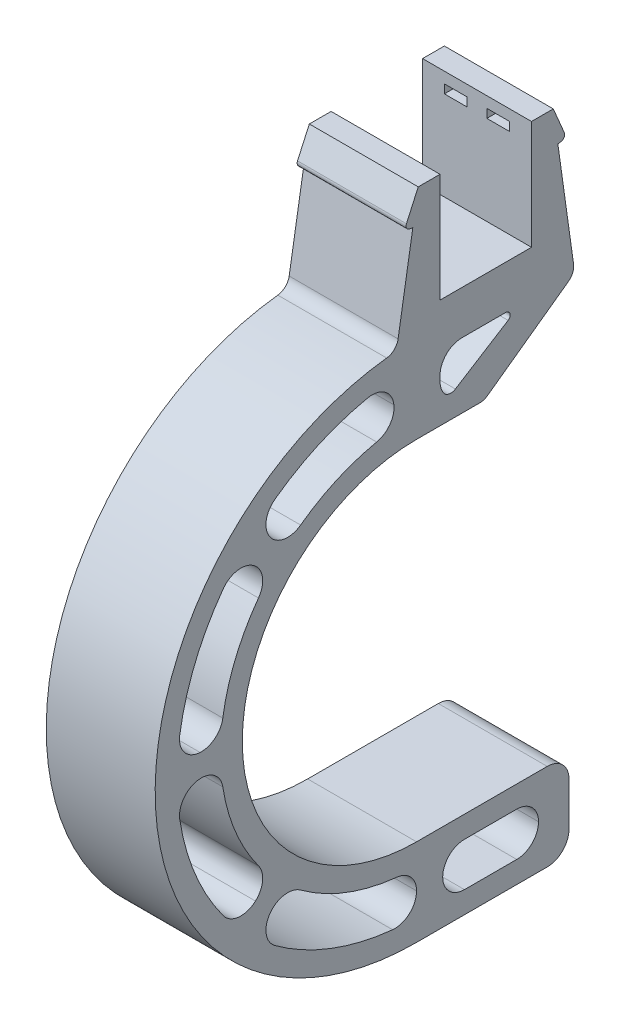
from build123d import *

# Parameters (mm, degrees)
SKETCH1_W               = 22
SKETCH1_H               = 10
BOSS_EXTRUDE1_DEPTH     = 25
FILLET1_R               = 5
FILLET2_R               = 5
FILLET3_R               = 5
FILLET4_R               = 5
FILLET5_R               = 2
FILLET6_R               = 1
FILLET7_R               = 3
FILLET8_R               = 5
CUT_EXTRUDE1_DEPTH      = 35
CUT_EXTRUDE1_DEPTH_BACK = 25
SKETCH2_W               = 5.25
SKETCH2_H               = 2
BOSS_EXTRUDE2_DEPTH     = 25
FILLET9_R               = 1


# Some blends are built 0.0001 mm under size
with BuildPart() as part:
    # Sketch1 → Boss-Extrude1 (new body)
    with BuildSketch(Plane(origin=(0, 0, 0), x_dir=(0, 0, -1), z_dir=(1, 0, 0))):
        with BuildLine():
            ThreePointArc((-15.5, -17.5), (-55.5, -57.5), (-15.5, -97.5))
            Line((-15.5, -97.5), (19.5, -97.5))
            Line((19.5, -97.5), (19.5, -117.5))
            Line((19.5, -117.5), (-15.5, -117.5))
            ThreePointArc((-15.5, -117.5), (-75.455538985, -59.809403615), (-20.115384615, 2.322221831))
            Line((-20.115384615, 2.322221831), (-15.115384615, 32.514814847))
            Line((-15.115384615, 32.514814847), (-10.115384615, 32.514814847))
            Line((-10.115384615, 32.514814847), (-10.115384615, 7.5))
            Line((-10.115384615, 7.5), (10.884615385, 7.5))
            Line((10.884615385, 7.5), (10.884615385, 32.514814847))
            Line((10.884615385, 32.514814847), (15.884615385, 32.514814847))
            Line((15.884615385, 32.514814847), (20.8, -2.5))
            Line((20.8, -2.5), (0, -17.5))
            Line((0, -17.5), (-15.5, -17.5))
        make_face()
        with BuildLine():
            ThreePointArc((-52.30218335, -98.372965401), (-35.210237225, -108.846923457), (-15.5, -112.5))
            Line((-15.5, -112.5), (-15.5, -102.5))
            ThreePointArc((-15.5, -102.5), (-31.62655773, -99.511119192), (-45.610877286, -90.941517146))
            Line((-45.610877286, -90.941517146), (-52.30218335, -98.372965401))
        make_face(mode=Mode.SUBTRACT)
        with BuildLine():
            ThreePointArc((-56.372965401, -20.69781665), (-66.313374288, -36.45241122), (-70.424624412, -54.621522407))
            Line((-70.424624412, -54.621522407), (-60.438329064, -55.144881969))
            ThreePointArc((-60.438329064, -55.144881969), (-57.074578963, -40.279245544), (-48.941517146, -27.389122714))
            Line((-48.941517146, -27.389122714), (-56.372965401, -20.69781665))
        make_face(mode=Mode.SUBTRACT)
        with BuildLine():
            ThreePointArc((-21.24906548, -2.801295755), (-37.870515369, -7.25499983), (-52.30218335, -16.627034599))
            Line((-52.30218335, -16.627034599), (-45.610877286, -24.058482854))
            ThreePointArc((-45.610877286, -24.058482854), (-33.803148938, -16.390454406), (-20.203780847, -12.746514708))
            Line((-20.203780847, -12.746514708), (-21.24906548, -2.801295755))
        make_face(mode=Mode.SUBTRACT)
        Polygon((8.463652775, -2.5), (-7.917479229, -12.773905232), (-10.115384615, -12.773905232), (-10.115384615, -2.5), align=None, mode=Mode.SUBTRACT)
        with Locations((1.5, -107.5)):
            Rectangle(SKETCH1_W, SKETCH1_H, mode=Mode.SUBTRACT)
        with BuildLine():
            Line((-60.438329064, -59.855118031), (-70.424624412, -60.378477593))
            ThreePointArc((-70.424624412, -60.378477593), (-66.313374288, -78.54758878), (-56.372965401, -94.30218335))
            Line((-56.372965401, -94.30218335), (-48.941517146, -87.610877286))
            ThreePointArc((-48.941517146, -87.610877286), (-57.074578963, -74.720754456), (-60.438329064, -59.855118031))
        make_face(mode=Mode.SUBTRACT)
    extrude(amount=-BOSS_EXTRUDE1_DEPTH)

    # Fillet1
    fillet1_edges = [part.edges().sort_by_distance(p)[0] for p in [
        (-12.5, -90.941517146, 45.610877286),
        (-12.5, -102.5, 9.5),
        (-12.5, -112.5, 9.5),
        (-12.5, -112.5, 15.5),
        (-12.5, -112.5, -12.5),
        (-12.5, -102.5, -12.5),
        (-12.5, -98.372965401, 52.30218335),
        (-12.5, -102.5, 15.5),
        (-12.5, -87.610877286, 48.941517146),
        (-12.5, -94.30218335, 56.372965401),
        (-12.5, -20.69781665, 56.372965401),
        (-12.5, -27.389122714, 48.941517146),
        (-12.5, -55.144881969, 60.438329064),
        (-12.5, -54.621522407, 70.424624412),
        (-12.5, -16.627034599, 52.30218335),
        (-12.5, -24.058482854, 45.610877286),
        (-12.5, -12.746514708, 20.203780847),
        (-12.5, -2.801295755, 21.24906548),
    ]]
    fillet(fillet1_edges, radius=FILLET1_R - 0.0001)  # a hair under: the kernel refuses the full size

    # Fillet2
    fillet2_edges = [part.edges().sort_by_distance(p)[0] for p in [
        (-12.5, -59.855118031, 60.438329064),
        (-12.5, -60.378477593, 70.424624412),
    ]]
    fillet(fillet2_edges, radius=FILLET2_R - 0.0001)  # a hair under: the kernel refuses the full size

    # Fillet3
    fillet3_edges = [part.edges().sort_by_distance(p)[0] for p in [
        (-12.5, -2.5, 10.115384615),
    ]]
    fillet(fillet3_edges, radius=FILLET3_R)

    # Fillet4
    # the kernel refuses this fillet: 5 mm, written as the material it adds along each edge
    with BuildSketch(Plane(origin=(0, -12.773905232, 10.115384615), x_dir=(0, 1, 0), z_dir=(-1, 0, 0))) as fillet4_piece_1:
        with BuildLine():
            CenterArc((4.141046459, 5), FILLET4_R, 214.08477399, 55.91522601)
            Line((0, 2.197905387), (-0.082820929, 2.141863494))
            ThreePointArc((-0.082820929, 2.141863494), (-0.1, 1.098952693), (-0.1, 0))
            Line((-0.1, 0), (0, -0.1))
            Line((0, -0.1), (4.141046459, -0.1))
            Line((4.141046459, -0.1), (4.141046459, 0))
        make_face()
    extrude(amount=25)

    # Fillet5
    fillet5_edges = [part.edges().sort_by_distance(p)[0] for p in [
        (-12.5, -12.773905232, 7.917479229),
    ]]
    fillet(fillet5_edges, radius=FILLET5_R)

    # Fillet6
    fillet6_edges = [part.edges().sort_by_distance(p)[0] for p in [
        (-12.5, -2.5, -8.463652775),
    ]]
    fillet(fillet6_edges, radius=FILLET6_R)

    # Fillet7
    fillet7_edges = [part.edges().sort_by_distance(p)[0] for p in [
        (-12.5, 2.322221831, 20.115384615),
        (-12.5, -2.5, -20.8),
        (-12.5, -17.5, 0),
    ]]
    fillet(fillet7_edges, radius=FILLET7_R)

    # Fillet8
    fillet8_edges = [part.edges().sort_by_distance(p)[0] for p in [
        (-12.5, -97.5, -19.5),
        (-12.5, -117.5, -19.5),
    ]]
    fillet(fillet8_edges, radius=FILLET8_R)

    # Sketch2 → Cut-Extrude1 (cut, two sides: drawn at the far end of the back side and taken through both)
    with BuildSketch(Plane.XY.offset(-10.884615385).offset(-CUT_EXTRUDE1_DEPTH_BACK)):
        with Locations((-17.375, 29)):
            Rectangle(SKETCH2_W, SKETCH2_H)
        with Locations((-7.625, 29)):
            Rectangle(SKETCH2_W, SKETCH2_H)
    extrude(amount=CUT_EXTRUDE1_DEPTH + CUT_EXTRUDE1_DEPTH_BACK, mode=Mode.SUBTRACT)

    # Sketch3 → Boss-Extrude2 (add)
    with BuildSketch(Plane(origin=(0, 0, 0), x_dir=(0, 0, -1), z_dir=(1, 0, 0))):
        Polygon((16.937466436, 25.014814847), (18.937466436, 25.295575128), (15.884615385, 32.514814847), align=None)
        Polygon((-16.357411095, 25.014814847), (-18.357411095, 25.346021908), (-15.115384615, 32.514814847), align=None)
    extrude(amount=-BOSS_EXTRUDE2_DEPTH)

    # Fillet9
    fillet9_edges = [part.edges().sort_by_distance(p)[0] for p in [
        (-12.5, 25.295575128, -18.937466436),
        (-12.5, 25.346021908, 18.357411095),
    ]]
    fillet(fillet9_edges, radius=FILLET9_R)


solid = part.part
